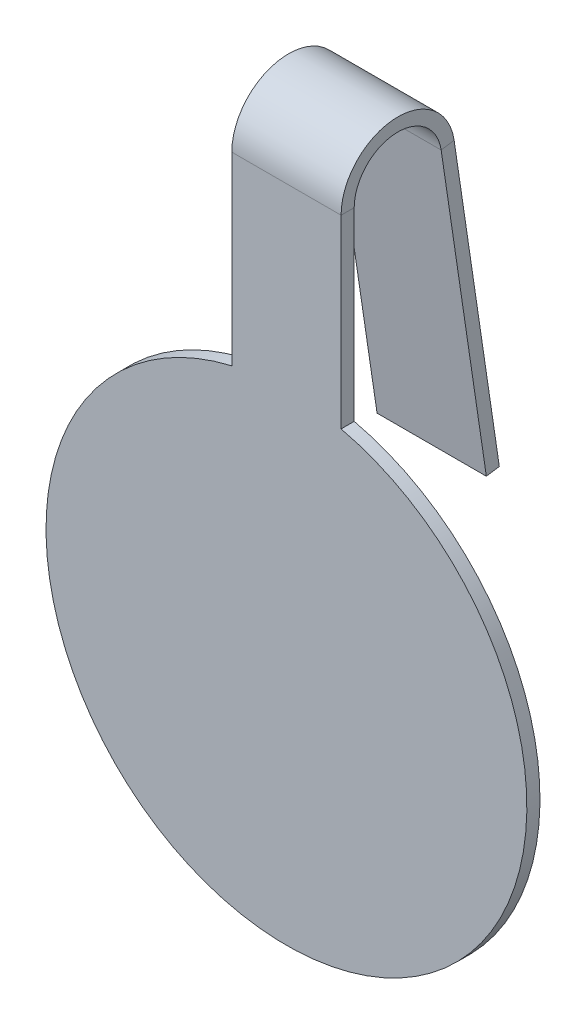
from build123d import *

# Parameters (mm, degrees)
BASE_EXTRUDE_DEPTH     = 3.81
SKETCHED_START         = -15.875
SKETCHED_BEND1_DEPTH   = 31.75
SKETCHED_BEND1_2_DEPTH = 31.75


# Read off the part's stored shape, not the designer's step: Sketched Bend1
with BuildPart() as part:
    # Sketch1 → Base-Extrude (new body)
    with BuildSketch(Plane.XY):
        with BuildLine():
            Line((15.875, 68.022105782), (15.875, 254))
            Line((15.875, 254), (-15.875, 254))
            Line((-15.875, 254), (-15.875, 68.022105782))
            ThreePointArc((-15.875, 68.022105782), (0, -69.85), (15.875, 68.022105782))
        make_face()
    extrude(amount=BASE_EXTRUDE_DEPTH)

    # Sketched Bend1 outline → Sketched Bend1 (cut)
    with BuildSketch(Plane.YZ.offset(SKETCHED_START)):
        with BuildLine():
            ThreePointArc((121.7921973, 3.81), (127.40036545, 2.828314461), (132.341609606, 0))
            Line((132.341609606, 0), (254, 0))
            Line((254, 0), (254, 3.81))
            Line((254, 3.81), (121.7921973, 3.81))
        make_face()
    extrude(amount=SKETCHED_BEND1_DEPTH, mode=Mode.SUBTRACT)

    # Sketched Bend1 2 outline → Sketched Bend1 2 (add)
    with BuildSketch(Plane.YZ.offset(SKETCHED_START)):
        with BuildLine():
            Line((123.653365296, -25.262883972), (35.007053077, -38.395670967))
            Line((35.007053077, -38.395670967), (35.565403476, -42.164536159))
            Line((35.565403476, -42.164536159), (124.211715695, -29.031749163))
            ThreePointArc((124.211715695, -29.031749163), (137.690590482, -17.152099982), (132.341609606, 0))
            Line((132.341609606, 0), (121.7921973, 0))
            ThreePointArc((121.7921973, 0), (134.457871906, -11.766894015), (123.653365296, -25.262883972))
        make_face()
    extrude(amount=SKETCHED_BEND1_2_DEPTH)


solid = part.part
